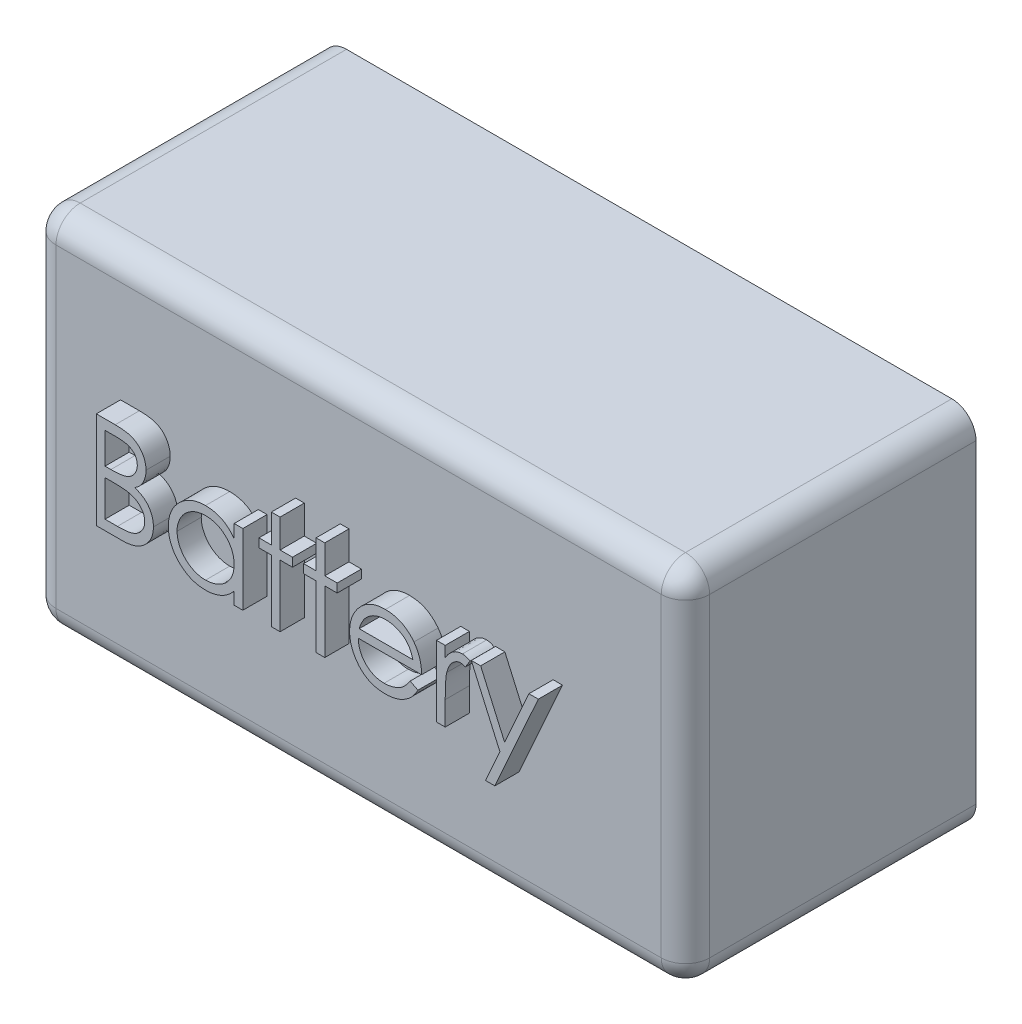
from build123d import *

# Parameters (mm, degrees)
SKETCH1_W           = 135
SKETCH1_H           = 75
BOSS_EXTRUDE1_DEPTH = 60
FILLET2_R           = 5
BOSS_EXTRUDE2_DEPTH = 5
FILLET4_R           = 5
FILLET5_R           = 5


with BuildPart() as part:
    # Sketch1 → Boss-Extrude1 (new body)
    with BuildSketch(Plane.XY):
        Rectangle(SKETCH1_W, SKETCH1_H)
    extrude(amount=BOSS_EXTRUDE1_DEPTH)

    # Fillet2
    fillet2_edges = [part.edges().sort_by_distance(p)[0] for p in [
        (67.5, 0, 60),
        (67.5, 37.5, 30),
        (0, 37.5, 60),
    ]]
    fillet(fillet2_edges, radius=FILLET2_R)

    # Sketch2 → Boss-Extrude2 (add)
    # profile 1 of 7: a face of its own
    with BuildSketch(Plane.XY.offset(60)):
        with BuildLine():
            Line((-49.168272795, 11.469638403), (-45.266029205, 11.469638403))
            add(Edge.make_bspline(
                [(-45.266029205, 11.469638403), (-45.075009329, 11.468634115), (-44.70476527, 11.466687555), (-44.16636846, 11.436498234), (-43.662089542, 11.395334406), (-43.191782271, 11.330019591), (-42.755663972, 11.251209436), (-42.352420331, 11.155770487), (-41.983333632, 11.041332695), (-41.542689424, 10.859353945), (-41.040285648, 10.58893584), (-40.496294832, 10.189344039), (-40.03112775, 9.700587107), (-39.63006308, 9.149257647), (-39.311199539, 8.542767523), (-39.08051784, 7.895572159), (-38.934472838, 7.216019348), (-38.919453214, 6.749486903), (-38.911862538, 6.513708916)],
                knots=[0, 0, 0, 0, 1.001505555, 1.941167018, 2.826882275, 3.653841531, 4.429895133, 5.150066043, 5.825578002, 6.45369114, 7.647487171, 8.808567382, 9.977351308, 11.170798116, 12.373658725, 13.556498008, 14.765093433, 16, 16, 16, 16], degree=3))
            add(Edge.make_bspline(
                [(-38.911862538, 6.513708916), (-38.918109501, 6.292837169), (-38.930385371, 5.858803358), (-39.047772567, 5.223979876), (-39.231547816, 4.619687197), (-39.487006382, 4.048130709), (-39.819017789, 3.522224348), (-40.212493896, 3.037725685), (-40.687218481, 2.615148216), (-41.042894138, 2.378903059), (-41.223561256, 2.258901224)],
                knots=[0, 0, 0, 0, 1.044552857, 2.05264487, 3.044412934, 4.028983338, 5.005914585, 5.980388656, 6.974128949, 8, 8, 8, 8], degree=3))
            add(Edge.make_bspline(
                [(-41.223561256, 2.258901224), (-40.996358813, 2.171672658), (-40.561664256, 2.004782804), (-39.963458471, 1.70972301), (-39.448059357, 1.388796665), (-39.011504237, 1.03832895), (-38.638146209, 0.660564317), (-38.3121294, 0.249963664), (-38.033950119, -0.198829238), (-37.795590555, -0.681135154), (-37.609597664, -1.192029259), (-37.470306782, -1.726719408), (-37.390492787, -2.283288295), (-37.379134837, -2.662061892), (-37.373401, -2.853278264)],
                knots=[0, 0, 0, 0, 1.27268992, 2.434971085, 3.483601985, 4.442670788, 5.356604649, 6.2567628, 7.179492994, 8.113709626, 9.066344395, 10.018646069, 10.999752585, 12, 12, 12, 12], degree=3))
            add(Edge.make_bspline(
                [(-37.373401, -2.853278264), (-37.378982977, -3.048517533), (-37.389965674, -3.432656265), (-37.470994084, -3.99697132), (-37.608188981, -4.536256729), (-37.79716696, -5.05400063), (-38.043808758, -5.549201398), (-38.343968554, -6.02242005), (-38.701863203, -6.468901939), (-39.102222455, -6.893608357), (-39.555149, -7.275481427), (-40.043810457, -7.61557118), (-40.574360856, -7.895262963), (-41.138086536, -8.130211657), (-41.7413112, -8.309681363), (-42.381326099, -8.435238928), (-43.057579252, -8.519839139), (-43.521634973, -8.526794596), (-43.759618948, -8.530361597)],
                knots=[0, 0, 0, 0, 0.978564426, 1.925352924, 2.850884081, 3.763762016, 4.682927383, 5.618979971, 6.567305752, 7.547517671, 8.540179244, 9.531824382, 10.526200242, 11.540722885, 12.589160233, 13.674978461, 14.80764778, 16, 16, 16, 16], degree=3))
            Line((-43.759618948, -8.530361597), (-49.168272795, -8.530361597))
            Line((-49.168272795, -8.530361597), (-49.168272795, 11.469638403))
        make_face()
        with BuildLine():
            Line((-47.373401, 9.418356352), (-47.373401, 3.008099941))
            Line((-47.373401, 3.008099941), (-46.167471512, 3.008099941))
            add(Edge.make_bspline(
                [(-46.167471512, 3.008099941), (-45.991192682, 3.010385216), (-45.650586058, 3.014800832), (-45.157329506, 3.0274495), (-44.699472259, 3.062866891), (-44.277804641, 3.098274103), (-43.892990676, 3.155843176), (-43.545882896, 3.224369592), (-43.23103377, 3.296843336), (-42.867950653, 3.420097546), (-42.456105233, 3.60225569), (-42.017058924, 3.884951897), (-41.630004812, 4.221662486), (-41.303163739, 4.610182268), (-41.035669622, 5.037989044), (-40.849876964, 5.498256932), (-40.723892483, 5.97951483), (-40.712512304, 6.309904846), (-40.706734333, 6.477651224)],
                knots=[0, 0, 0, 0, 1.156816544, 2.235205308, 3.236616184, 4.169592532, 5.011045266, 5.787822928, 6.49130361, 7.128639758, 8.301311294, 9.436451833, 10.541879658, 11.654887649, 12.756523258, 13.837046038, 14.901820046, 16, 16, 16, 16], degree=3))
            add(Edge.make_bspline(
                [(-40.706734333, 6.477651224), (-40.709741077, 6.588655632), (-40.715639133, 6.806402901), (-40.76394372, 7.123827782), (-40.846044145, 7.422363511), (-40.951497249, 7.706101284), (-41.098861185, 7.966169), (-41.272366689, 8.211558689), (-41.481999205, 8.433913652), (-41.720612421, 8.641739357), (-41.994947408, 8.825993801), (-42.304840504, 8.987369591), (-42.654484373, 9.117316886), (-43.037986402, 9.231123472), (-43.461249759, 9.311056579), (-43.919390064, 9.377647366), (-44.416159887, 9.411548749), (-44.759846187, 9.416036537), (-44.937503564, 9.418356352)],
                knots=[0, 0, 0, 0, 0.91205012, 1.789085906, 2.630437955, 3.453916878, 4.269457761, 5.079663411, 5.91843418, 6.774407191, 7.675494373, 8.627863946, 9.638891023, 10.736472738, 11.911756761, 13.175263542, 14.539845004, 16, 16, 16, 16], degree=3))
            Line((-44.937503564, 9.418356352), (-47.373401, 9.418356352))
        make_face(mode=Mode.SUBTRACT)
        with BuildLine():
            Line((-47.373401, 0.95681789), (-47.373401, -6.479079546))
            Line((-47.373401, -6.479079546), (-44.817311256, -6.479079546))
            add(Edge.make_bspline(
                [(-44.817311256, -6.479079546), (-44.634345965, -6.476886703), (-44.281704488, -6.472660289), (-43.772554601, -6.458862834), (-43.300651151, -6.427478402), (-42.868147518, -6.378073547), (-42.470373503, -6.324482408), (-42.112100914, -6.252417946), (-41.790425523, -6.169852457), (-41.417429479, -6.042228616), (-40.997409432, -5.843963068), (-40.544775967, -5.545024631), (-40.142340434, -5.188891444), (-39.800596096, -4.776714792), (-39.520521876, -4.328535781), (-39.316776418, -3.853419495), (-39.19111438, -3.359216481), (-39.175901984, -3.022263838), (-39.168272795, -2.853278264)],
                knots=[0, 0, 0, 0, 1.160039823, 2.235823828, 3.228722157, 4.157150951, 4.99529583, 5.772374946, 6.472645482, 7.099169577, 8.269452708, 9.405989375, 10.527446681, 11.663510218, 12.788923519, 13.866172445, 14.929861265, 16, 16, 16, 16], degree=3))
            add(Edge.make_bspline(
                [(-39.168272795, -2.853278264), (-39.169850534, -2.747602032), (-39.172980563, -2.537954136), (-39.220184077, -2.229863741), (-39.288834761, -1.931430179), (-39.377585812, -1.641843091), (-39.506839909, -1.366338083), (-39.657734452, -1.099466314), (-39.834656748, -0.840875003), (-40.110337695, -0.513947841), (-40.511320464, -0.137279195), (-41.081073467, 0.231506532), (-41.728915169, 0.528922572), (-42.198786557, 0.655205294), (-42.441509974, 0.720439685)],
                knots=[0, 0, 0, 0, 0.723448775, 1.435228256, 2.130040452, 2.821711965, 3.505591119, 4.210454504, 4.921174351, 5.648778258, 7.137944449, 8.670945889, 10.280296675, 12, 12, 12, 12], degree=3))
            add(Edge.make_bspline(
                [(-42.441509974, 0.720439685), (-42.538819093, 0.740183022), (-42.749805335, 0.782990649), (-43.093848652, 0.828177525), (-43.486625046, 0.86843501), (-43.929041487, 0.898213054), (-44.421657722, 0.928993303), (-44.965525829, 0.940963709), (-45.55842477, 0.955245196), (-45.969809755, 0.956280248), (-46.183497154, 0.95681789)],
                knots=[0, 0, 0, 0, 0.634451884, 1.375622551, 2.216452059, 3.157844607, 4.20941857, 5.370758133, 6.634282058, 8, 8, 8, 8], degree=3))
            Line((-46.183497154, 0.95681789), (-47.373401, 0.95681789))
        make_face(mode=Mode.SUBTRACT)
    # profile 2 of 7: a face of its own
    with BuildSketch(Plane.XY.offset(60)):
        with BuildLine():
            Line((-18.911862538, 6.085023018), (-18.911862538, -8.530361597))
            Line((-18.911862538, -8.530361597), (-20.706734333, -8.530361597))
            Line((-20.706734333, -8.530361597), (-20.706734333, -6.002316725))
            add(Edge.make_bspline(
                [(-20.706734333, -6.002316725), (-20.909127422, -6.231114405), (-21.304100081, -6.677615954), (-21.963763612, -7.260942654), (-22.663010343, -7.743104491), (-23.398446464, -8.132532581), (-24.169407854, -8.425058617), (-24.974185496, -8.632979527), (-25.813107672, -8.766658585), (-26.385978271, -8.780007281), (-26.676285615, -8.786771853)],
                knots=[0, 0, 0, 0, 1.074387032, 2.096679803, 3.090159297, 4.057316773, 5.018401886, 5.985159533, 6.978961417, 8, 8, 8, 8], degree=3))
            add(Edge.make_bspline(
                [(-26.676285615, -8.786771853), (-26.934388208, -8.779764012), (-27.443377951, -8.765944238), (-28.192115534, -8.658731075), (-28.912642674, -8.486556094), (-29.605640232, -8.247122439), (-30.26662392, -7.929517744), (-30.901253044, -7.549282041), (-31.506239856, -7.096477298), (-32.072362935, -6.578831422), (-32.593688652, -6.016574352), (-33.051181638, -5.416885513), (-33.432627809, -4.782358062), (-33.751599699, -4.121025754), (-33.997293095, -3.427797642), (-34.168571005, -2.705070968), (-34.275659272, -1.953700262), (-34.289473333, -1.442045845), (-34.296477923, -1.182605187)],
                knots=[0, 0, 0, 0, 1.033919861, 2.038935746, 3.024066025, 3.998881131, 4.97069526, 5.957263378, 6.95902576, 7.993208707, 9.027059324, 10.027763471, 11.009749337, 11.988697705, 12.965288445, 13.950418724, 14.960734635, 16, 16, 16, 16], degree=3))
            add(Edge.make_bspline(
                [(-34.296477923, -1.182605187), (-34.289318086, -0.928526881), (-34.275163476, -0.426227776), (-34.169716505, 0.312507641), (-33.992396456, 1.02404056), (-33.743551612, 1.706080235), (-33.424454726, 2.35945195), (-33.036294229, 2.984617808), (-32.579042088, 3.583300079), (-32.051885477, 4.141421375), (-31.480829647, 4.656967742), (-30.869922613, 5.10501943), (-30.234361006, 5.491972852), (-29.56428666, 5.798564145), (-28.86961749, 6.046616171), (-28.144169228, 6.218233132), (-27.390960207, 6.319360682), (-26.879585967, 6.334005048), (-26.620195871, 6.341433275)],
                knots=[0, 0, 0, 0, 1.020392517, 2.01726096, 2.990465484, 3.961182959, 4.928053699, 5.906110375, 6.912531644, 7.948652711, 8.985773172, 9.998621852, 10.987621588, 11.969261332, 12.953316658, 13.946091881, 14.958173133, 16, 16, 16, 16], degree=3))
            add(Edge.make_bspline(
                [(-26.620195871, 6.341433275), (-26.321910963, 6.333217552), (-25.736988334, 6.317106906), (-24.88139971, 6.183034179), (-24.072002693, 5.956528652), (-23.302549253, 5.648428664), (-22.575802475, 5.239007355), (-21.898642565, 4.722550434), (-21.26398266, 4.10231508), (-20.896095279, 3.625912541), (-20.706734333, 3.380696095)],
                knots=[0, 0, 0, 0, 1.038897134, 2.037228247, 3.008116434, 3.962042015, 4.918381754, 5.904844433, 6.921570401, 8, 8, 8, 8], degree=3))
            Line((-20.706734333, 3.380696095), (-20.706734333, 6.085023018))
            Line((-20.706734333, 6.085023018), (-18.911862538, 6.085023018))
        make_face()
        with BuildLine():
            add(Edge.make_bspline(
                [(-26.59615741, 4.54656148), (-26.858525055, 4.537226407), (-27.376397055, 4.518800458), (-28.136648495, 4.374951915), (-28.864153718, 4.135611375), (-29.555274143, 3.808286226), (-30.199092524, 3.396693445), (-30.774484928, 2.898856969), (-31.286157507, 2.328359745), (-31.716490446, 1.687776257), (-32.067293285, 1.001044308), (-32.313962039, 0.283190376), (-32.476643453, -0.452838067), (-32.493263571, -0.952053414), (-32.501606128, -1.202637238)],
                knots=[0, 0, 0, 0, 1.031046209, 2.035121221, 3.029706178, 4.034933723, 5.034054252, 6.02443088, 7.017295772, 8.038157696, 9.050218397, 10.03989886, 11.016116709, 12, 12, 12, 12], degree=3))
            add(Edge.make_bspline(
                [(-32.501606128, -1.202637238), (-32.490949595, -1.451723565), (-32.469678298, -1.948919884), (-32.316817187, -2.685951751), (-32.060360768, -3.403974849), (-31.710406124, -4.096894812), (-31.27219684, -4.740232528), (-30.764261682, -5.321604657), (-30.181688646, -5.821545161), (-29.536388606, -6.240045582), (-28.847200203, -6.57811713), (-28.122434881, -6.813349356), (-27.375716948, -6.965222388), (-26.867989326, -6.982962256), (-26.612183051, -6.991900059)],
                knots=[0, 0, 0, 0, 0.979072187, 1.954306742, 2.945804271, 3.96968567, 4.997920485, 5.998718438, 6.996577872, 8.005894225, 9.015743152, 10.005417472, 10.995077863, 12, 12, 12, 12], degree=3))
            add(Edge.make_bspline(
                [(-26.612183051, -6.991900059), (-26.352488749, -6.98241455), (-25.835982541, -6.963548815), (-25.073475639, -6.819084442), (-24.333504423, -6.580405595), (-23.626148832, -6.249553442), (-22.967199511, -5.839511408), (-22.375783068, -5.359470888), (-21.87569182, -4.801166979), (-21.451734051, -4.187587247), (-21.119303098, -3.514947267), (-20.877154188, -2.798751892), (-20.733989013, -2.038976188), (-20.715944843, -1.519753748), (-20.706734333, -1.254720571)],
                knots=[0, 0, 0, 0, 1.01762866, 2.023962475, 3.030623092, 4.058876274, 5.077231937, 6.066672613, 7.034107872, 8.005628644, 8.981990164, 9.965428785, 10.961468474, 12, 12, 12, 12], degree=3))
            add(Edge.make_bspline(
                [(-20.706734333, -1.254720571), (-20.712218084, -1.052790111), (-20.72301184, -0.655327064), (-20.805472238, -0.071741249), (-20.936643246, 0.486737186), (-21.121478503, 1.020695409), (-21.364285843, 1.527181211), (-21.657130219, 2.009831269), (-22.00516136, 2.466135334), (-22.402776767, 2.889810026), (-22.838006496, 3.276246953), (-23.298546728, 3.621185471), (-23.789853853, 3.904549887), (-24.303665493, 4.139071438), (-24.840873118, 4.325695152), (-25.405848089, 4.450196259), (-25.992585157, 4.535683808), (-26.39284833, 4.542897412), (-26.59615741, 4.54656148)],
                knots=[0, 0, 0, 0, 1.050140795, 2.067009409, 3.05949893, 4.030605086, 5.00011959, 5.97591094, 6.962425594, 7.979863591, 8.993523472, 9.986985069, 10.967611495, 11.937549037, 12.921786183, 13.919465291, 14.943216303, 16, 16, 16, 16], degree=3))
        make_face(mode=Mode.SUBTRACT)
    # profile 3 of 7: a face of its own
    with BuildSketch(Plane.XY.offset(60)):
        Polygon((-13.014426641, 11.982458916), (-11.219554846, 11.982458916), (-11.219554846, 6.085023018), (-8.655452282, 6.085023018), (-8.655452282, 4.290151224), (-11.219554846, 4.290151224), (-11.219554846, -8.530361597), (-13.014426641, -8.530361597), (-13.014426641, 4.290151224), (-15.578529205, 4.290151224), (-15.578529205, 6.085023018), (-13.014426641, 6.085023018), align=None)
    # profile 4 of 7: a face of its own
    with BuildSketch(Plane.XY.offset(60)):
        Polygon((-3.78365741, 11.982458916), (-1.988785615, 11.982458916), (-1.988785615, 6.085023018), (0.575316949, 6.085023018), (0.575316949, 4.290151224), (-1.988785615, 4.290151224), (-1.988785615, -8.530361597), (-3.78365741, -8.530361597), (-3.78365741, 4.290151224), (-6.347759974, 4.290151224), (-6.347759974, 6.085023018), (-3.78365741, 6.085023018), align=None)
    # profile 5 of 7: a face of its own
    with BuildSketch(Plane.XY.offset(60)):
        with BuildLine():
            Line((15.647432334, -3.914976982), (17.241983616, -4.752316725))
            add(Edge.make_bspline(
                [(17.241983616, -4.752316725), (17.114917357, -4.97770719), (16.867696737, -5.416227777), (16.442549606, -6.018695551), (15.99688062, -6.560682499), (15.510572232, -7.027709095), (14.998174066, -7.434859866), (14.45684461, -7.791076007), (13.883765652, -8.094610409), (13.278910082, -8.35033914), (12.637198361, -8.546964821), (11.95707541, -8.685846083), (11.237238294, -8.771693332), (10.743831551, -8.781665565), (10.491182334, -8.786771853)],
                knots=[0, 0, 0, 0, 1.120438281, 2.179929193, 3.190490725, 4.156257408, 5.095198341, 6.022838206, 6.959905092, 7.901321166, 8.864066838, 9.862729781, 10.905609505, 12, 12, 12, 12], degree=3))
            add(Edge.make_bspline(
                [(10.491182334, -8.786771853), (10.210371033, -8.780216566), (9.662589538, -8.767429099), (8.865219555, -8.657186445), (8.114480021, -8.477344395), (7.410413145, -8.22611273), (6.75474313, -7.897956592), (6.146166817, -7.498188124), (5.581483812, -7.028860955), (5.078488331, -6.485909849), (4.625666144, -5.904870093), (4.22609003, -5.299407896), (3.892047567, -4.671046613), (3.620318365, -4.023786476), (3.400861994, -3.361707084), (3.247909401, -2.678784412), (3.159739413, -1.976866788), (3.146228295, -1.50202487), (3.139419513, -1.262733392)],
                knots=[0, 0, 0, 0, 1.145258523, 2.234067595, 3.276747158, 4.290159414, 5.277019952, 6.260822364, 7.254936242, 8.264827045, 9.274100331, 10.257902744, 11.220704747, 12.172965371, 13.118907548, 14.062713208, 15.023725156, 16, 16, 16, 16], degree=3))
            add(Edge.make_bspline(
                [(3.139419513, -1.262733392), (3.145471749, -1.038191504), (3.157466482, -0.593179134), (3.233070982, 0.06548112), (3.367061228, 0.705643706), (3.550925936, 1.327840552), (3.788361628, 1.931029889), (4.078831453, 2.515578824), (4.422787897, 3.080865337), (4.688346033, 3.437454673), (4.822111821, 3.6170743)],
                knots=[0, 0, 0, 0, 1.024358464, 2.0301432, 3.019427413, 4.004406732, 4.986367066, 5.972626655, 6.978780325, 8, 8, 8, 8], degree=3))
            add(Edge.make_bspline(
                [(4.822111821, 3.6170743), (5.00329858, 3.833467844), (5.35993256, 4.259400132), (5.963111734, 4.819047708), (6.616255713, 5.28786928), (7.31117929, 5.676481487), (8.055959142, 5.97175947), (8.840583662, 6.191802797), (9.673987012, 6.315105717), (10.243731131, 6.332521909), (10.535252846, 6.341433275)],
                knots=[0, 0, 0, 0, 1.030682036, 2.02871468, 2.997146059, 3.962720338, 4.930598197, 5.918074684, 6.934738563, 8, 8, 8, 8], degree=3))
            add(Edge.make_bspline(
                [(10.535252846, 6.341433275), (10.834953448, 6.333695853), (11.422897711, 6.318516794), (12.280224117, 6.177794889), (13.091428211, 5.954637434), (13.856185379, 5.639472917), (14.574573154, 5.232846907), (15.241922009, 4.729179241), (15.869644938, 4.143933028), (16.234836817, 3.693857546), (16.420669513, 3.464830711)],
                knots=[0, 0, 0, 0, 1.056321875, 2.072262726, 3.055038591, 4.01806755, 4.982017516, 5.957941055, 6.960871419, 8, 8, 8, 8], degree=3))
            add(Edge.make_bspline(
                [(16.420669513, 3.464830711), (16.547109161, 3.292238817), (16.799146835, 2.948203853), (17.11484455, 2.387225813), (17.388886807, 1.800308131), (17.607932299, 1.177963576), (17.785300877, 0.527565975), (17.913625555, -0.155534281), (17.988880519, -0.871133774), (18.003673075, -1.358714091), (18.011214385, -1.607284674)],
                knots=[0, 0, 0, 0, 0.94817472, 1.890038105, 2.849395472, 3.817997239, 4.812318967, 5.836947057, 6.897266129, 8, 8, 8, 8], degree=3))
            Line((18.011214385, -1.607284674), (4.934291308, -1.607284674))
            add(Edge.make_bspline(
                [(4.934291308, -1.607284674), (4.943089059, -1.799858755), (4.960389482, -2.17854792), (5.041047443, -2.73266668), (5.168183293, -3.26051435), (5.346863651, -3.758131732), (5.563245624, -4.232018175), (5.828306862, -4.678658386), (6.144532885, -5.096017987), (6.497251167, -5.487830202), (6.88986314, -5.836748837), (7.30290741, -6.149044701), (7.74229921, -6.410790968), (8.204573973, -6.623247481), (8.688984174, -6.789569287), (9.195682432, -6.903099691), (9.723671668, -6.979140302), (10.083590148, -6.987595531), (10.266823359, -6.991900059)],
                knots=[0, 0, 0, 0, 1.094153842, 2.151609401, 3.174256925, 4.172055639, 5.149267565, 6.128595816, 7.11444997, 8.118368179, 9.117203808, 10.09244225, 11.054858984, 12.015122123, 12.976791628, 13.957293641, 14.960065497, 16, 16, 16, 16], degree=3))
            add(Edge.make_bspline(
                [(10.266823359, -6.991900059), (10.445972774, -6.988425449), (10.801439579, -6.981531157), (11.330815907, -6.914491666), (11.851613207, -6.806090091), (12.361675968, -6.658147291), (12.85065223, -6.477708136), (13.303483945, -6.259977521), (13.71994232, -6.019121825), (14.109182129, -5.743637968), (14.486730663, -5.406448328), (14.861259156, -4.985672779), (15.262840033, -4.488029763), (15.514209134, -4.113483101), (15.647432334, -3.914976982)],
                knots=[0, 0, 0, 0, 0.99110716, 1.966546729, 2.947904876, 3.932708344, 4.903319531, 5.828989031, 6.710028674, 7.56322171, 8.463672341, 9.504779593, 10.677557249, 12, 12, 12, 12], degree=3))
        make_face()
        with BuildLine():
            add(Edge.make_bspline(
                [(16.21634259, 0.187587121), (16.150647593, 0.425660685), (16.02420587, 0.88387566), (15.759998073, 1.518395034), (15.462446412, 2.082325897), (15.110322233, 2.571352371), (14.711358086, 3.00565816), (14.250528471, 3.385192932), (13.733751937, 3.724721224), (13.163699704, 4.011306935), (12.560032361, 4.255248985), (11.927996978, 4.418821075), (11.283095333, 4.530875603), (10.846899411, 4.541310508), (10.627400282, 4.54656148)],
                knots=[0, 0, 0, 0, 1.154881502, 2.222775134, 3.210006277, 4.132804581, 5.035138423, 5.962687519, 6.919655026, 7.923214229, 8.944639381, 9.960483929, 10.97369054, 12, 12, 12, 12], degree=3))
            add(Edge.make_bspline(
                [(10.627400282, 4.54656148), (10.448260634, 4.543066214), (10.094139211, 4.536156808), (9.572418821, 4.470613212), (9.07139197, 4.362271241), (8.587361755, 4.213900061), (8.126671079, 4.016136618), (7.679843832, 3.784232466), (7.258241567, 3.501137701), (6.994577022, 3.285372816), (6.861374641, 3.176369172)],
                knots=[0, 0, 0, 0, 1.04873581, 2.073130211, 3.073294108, 4.04793562, 5.032784715, 6.005352987, 6.992311501, 8, 8, 8, 8], degree=3))
            add(Edge.make_bspline(
                [(6.861374641, 3.176369172), (6.765984459, 3.09011594), (6.572937977, 2.91556042), (6.31499214, 2.614822097), (6.068018011, 2.290527456), (5.843254281, 1.930269601), (5.637096644, 1.538150864), (5.444182488, 1.117478662), (5.270545848, 0.665060775), (5.172853791, 0.349789694), (5.12259259, 0.187587121)],
                knots=[0, 0, 0, 0, 0.879870761, 1.780643979, 2.707998968, 3.669668524, 4.684282772, 5.740141944, 6.837334558, 8, 8, 8, 8], degree=3))
            Line((5.12259259, 0.187587121), (16.21634259, 0.187587121))
        make_face(mode=Mode.SUBTRACT)
    # profile 6 of 7: a face of its own
    with BuildSketch(Plane.XY.offset(60)):
        with BuildLine():
            Line((21.088137462, 6.085023018), (22.883009257, 6.085023018))
            Line((22.883009257, 6.085023018), (22.883009257, 3.933580711))
            add(Edge.make_bspline(
                [(22.883009257, 3.933580711), (23.01551645, 4.13389973), (23.268935426, 4.517008297), (23.690152166, 5.023690017), (24.121599773, 5.443204569), (24.5653437, 5.777510391), (25.024647128, 6.02787107), (25.48942971, 6.211259841), (25.967003823, 6.319701643), (26.287929104, 6.334179694), (26.448714385, 6.341433275)],
                knots=[0, 0, 0, 0, 1.2804753, 2.448899062, 3.506932113, 4.484331642, 5.4025378, 6.288909075, 7.142734305, 8, 8, 8, 8], degree=3))
            add(Edge.make_bspline(
                [(26.448714385, 6.341433275), (26.573436251, 6.334630266), (26.830059595, 6.320632632), (27.218531536, 6.222285063), (27.618779833, 6.065267791), (27.876736332, 5.917609376), (28.011214385, 5.840631993)],
                knots=[0, 0, 0, 0, 0.901110191, 1.854092781, 2.881294221, 4, 4, 4, 4], degree=3))
            Line((28.011214385, 5.840631993), (27.025637462, 4.286144813))
            add(Edge.make_bspline(
                [(27.025637462, 4.286144813), (26.939300198, 4.32466062), (26.775415544, 4.397770993), (26.535675165, 4.484296766), (26.314638955, 4.535244856), (26.173818622, 4.542963242), (26.108169513, 4.54656148)],
                knots=[0, 0, 0, 0, 1.180555205, 2.24091978, 3.179933427, 4, 4, 4, 4], degree=3))
            add(Edge.make_bspline(
                [(26.108169513, 4.54656148), (25.96413675, 4.536961266), (25.670351665, 4.517379614), (25.239011668, 4.363443569), (24.820456208, 4.114727911), (24.488046709, 3.838892987), (24.230662407, 3.572905573), (24.047003975, 3.340628986), (23.878531136, 3.080179663), (23.717558448, 2.796010042), (23.570893909, 2.483268064), (23.434010085, 2.145078273), (23.310245154, 1.781048966), (23.23967233, 1.527434565), (23.203522077, 1.397523018)],
                knots=[0, 0, 0, 0, 1.125678352, 2.296057538, 3.5422874, 4.923748041, 5.663163013, 6.437101912, 7.23742474, 8.08941207, 8.991984279, 9.93940061, 10.944477711, 12, 12, 12, 12], degree=3))
            add(Edge.make_bspline(
                [(23.203522077, 1.397523018), (23.176479829, 1.281653455), (23.116583305, 1.025011177), (23.058345946, 0.594448179), (23.000805844, 0.085741557), (22.960253739, -0.502524688), (22.922664927, -1.16888151), (22.901464457, -1.914344057), (22.883732225, -2.739677492), (22.883257557, -3.316673796), (22.883009257, -3.618502623)],
                knots=[0, 0, 0, 0, 0.566838948, 1.255505196, 2.06880316, 3.007127437, 4.065329342, 5.249902469, 6.561414163, 8, 8, 8, 8], degree=3))
            Line((22.883009257, -3.618502623), (22.883009257, -8.530361597))
            Line((22.883009257, -8.530361597), (21.088137462, -8.530361597))
            Line((21.088137462, -8.530361597), (21.088137462, 6.085023018))
        make_face()
    # profile 7 of 7: a face of its own
    with BuildSketch(Plane.XY.offset(60)):
        Polygon((28.267624641, 6.085023018), (30.202720795, 6.085023018), (35.150637462, -5.108887238), (40.174675923, 6.085023018), (42.113778488, 6.085023018), (33.139419513, -13.914976982), (31.200316949, -13.914976982), (34.17707977, -7.284368007), align=None)
    extrude(amount=BOSS_EXTRUDE2_DEPTH)

    # Fillet4
    fillet4_edges = [part.edges().sort_by_distance(p)[0] for p in [
        (-2.5, -37.5, 60),
        (66.035533906, -37.5, 58.535533906),
        (67.5, -37.5, 27.5),
    ]]
    fillet(fillet4_edges, radius=FILLET4_R)

    # Fillet5
    fillet5_edges = [part.edges().sort_by_distance(p)[0] for p in [
        (-67.5, 37.5, 27.5),
        (-67.5, 36.035533906, 58.535533906),
        (-67.5, 0, 60),
        (-67.5, -36.035533906, 58.535533906),
        (-67.5, -37.5, 27.5),
    ]]
    fillet(fillet5_edges, radius=FILLET5_R)


solid = part.part
